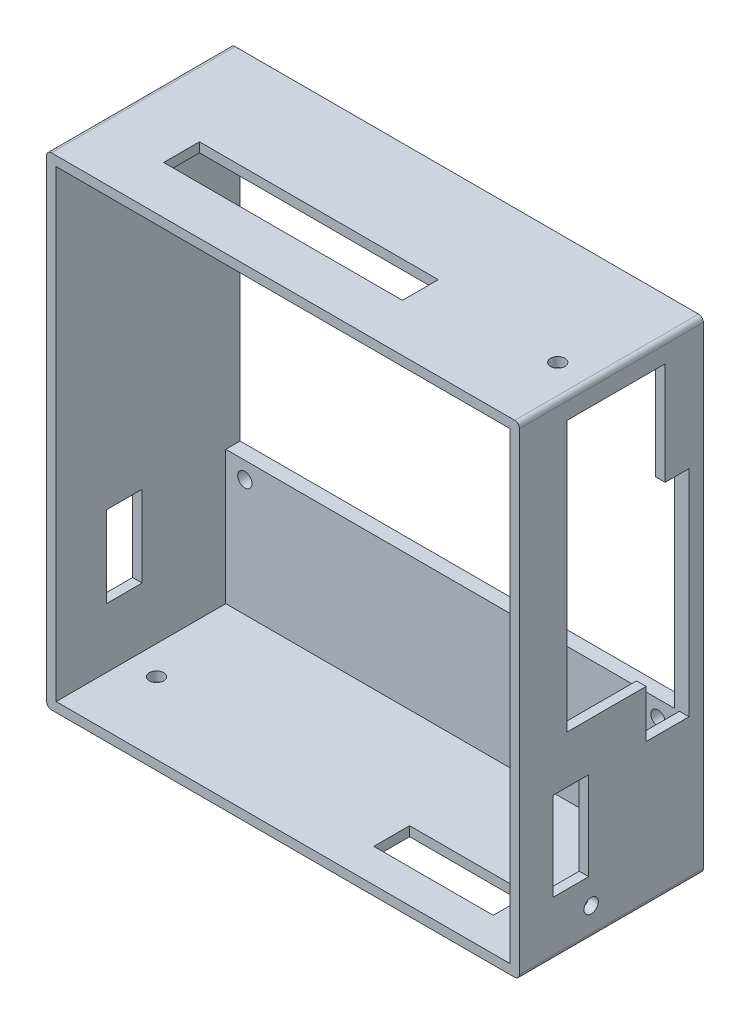
from build123d import *

# Parameters (mm, degrees)
SKETCH_1_W           = 99
SKETCH_1_H           = 104
SKETCH_1_R           = 1.5
SKETCH_1_W_2         = 95
SKETCH_1_H_2         = 61
EXTRUDE_3_DEPTH      = 3
SKETCH_3_W           = 99
SKETCH_3_H           = 104
SKETCH_3_W_2         = 95
SKETCH_3_H_2         = 100
EXTRUDE_4_DEPTH      = 33
CUT_EXTRUDE_2_DEPTH  = 30
SKETCH_5_W           = 50
SKETCH_5_H           = 7.5
CUT_EXTRUDE_3_DEPTH  = 30
SKETCH_6_W           = 28
SKETCH_6_H           = 55
CUT_EXTRUDE_4_DEPTH  = 30
SKETCH_7_W           = 7.5
SKETCH_7_H           = 18.5
CUT_EXTRUDE_5_DEPTH  = 30
SKETCH_8_W           = 25
SKETCH_8_H           = 7.5
CUT_EXTRUDE_6_DEPTH  = 30
FILLET_1_R           = 1
SKETCH_9_W           = 2
SKETCH_9_H           = 55
EXTRUDE_5_DEPTH      = 7.5
SKETCH_14_W          = 95
SKETCH_14_H          = 33
SKETCH_14_W_2        = 25
SKETCH_14_H_2        = 7.5
EXTRUDE_6_DEPTH      = 3
SKETCH_15_W          = 178.19226754
SKETCH_15_H          = 134.394802541
CUT_EXTRUDE_8_DEPTH  = 3
EXTRUDE_7_DEPTH      = 3
SKETCH_17_W          = 7.5
SKETCH_17_H          = 17
CUT_EXTRUDE_9_DEPTH  = 3
FILLET_3_R           = 1
SKETCH_19_W          = 95
SKETCH_19_H          = 97
EXTRUDE_8_DEPTH      = 2.5
SKETCH_20_W          = 2
SKETCH_20_H          = 20.5
EXTRUDE_9_DEPTH      = 2.5
CUT_EXTRUDE_10_DEPTH = 2
EXTRUDE_11_DEPTH     = 2
SKETCH_24_R          = 1.5
CUT_EXTRUDE_11_DEPTH = 2
SKETCH_25_R          = 1.5
CUT_EXTRUDE_12_DEPTH = 2
SKETCH_26_R          = 1.5
CUT_EXTRUDE_13_DEPTH = 2
SKETCH_27_R          = 1.5
CUT_EXTRUDE_14_DEPTH = 2
SKETCH_28_W          = 2
SKETCH_28_H          = 16.5
CUT_EXTRUDE_15_DEPTH = 4
SKETCH_29_W          = 6
SKETCH_29_H          = 7.5
EXTRUDE_12_DEPTH     = 2
SKETCH_30_W          = 6
SKETCH_30_H          = 7.5
CUT_EXTRUDE_16_DEPTH = 2


with BuildPart() as part:
    # 草图1 → 凸台-拉伸3 (new body)
    with BuildSketch(Plane.XY):
        with Locations((0, -11.5)):
            Rectangle(SKETCH_1_W, SKETCH_1_H)
        with Locations((43, 34)):
            Circle(SKETCH_1_R, mode=Mode.SUBTRACT)
        with Locations((-43.5, 34)):
            Circle(SKETCH_1_R, mode=Mode.SUBTRACT)
        with Locations((-43.5, -34)):
            Circle(SKETCH_1_R, mode=Mode.SUBTRACT)
        with Locations((43, -34)):
            Circle(SKETCH_1_R, mode=Mode.SUBTRACT)
        Rectangle(SKETCH_1_W_2, SKETCH_1_H_2, mode=Mode.SUBTRACT)
    extrude(amount=EXTRUDE_3_DEPTH)

    # 草图3 → 凸台-拉伸4 (add)
    with BuildSketch(Plane.XY.offset(3)):
        with Locations((0, -11.5)):
            Rectangle(SKETCH_3_W, SKETCH_3_H)
        with Locations((0, -11.5)):
            Rectangle(SKETCH_3_W_2, SKETCH_3_H_2, mode=Mode.SUBTRACT)
    extrude(amount=EXTRUDE_4_DEPTH)

    # 草图4 → 切除-拉伸2 (cut)
    with BuildSketch(Plane.ZY.offset(-47.5)):
        Polygon((12, 14.5), (12, -30.5), (3, -30.5), (0, -30.5), (0, 14.5), align=None)
    extrude(amount=-CUT_EXTRUDE_2_DEPTH, mode=Mode.SUBTRACT)

    # 草图5 → 切除-拉伸3 (cut)
    with BuildSketch(Plane(origin=(0, 40.5, 0), x_dir=(1, 0, 0), z_dir=(0, 1, 0))):
        with Locations((-10, -24.75)):
            Rectangle(SKETCH_5_W, SKETCH_5_H)
    extrude(amount=-CUT_EXTRUDE_3_DEPTH, mode=Mode.SUBTRACT)

    # 草图6 → 切除-拉伸4 (cut)
    with BuildSketch(Plane.ZY.offset(-47.5)):
        with Locations((22, 11)):
            Rectangle(SKETCH_6_W, SKETCH_6_H)
    extrude(amount=-CUT_EXTRUDE_4_DEPTH, mode=Mode.SUBTRACT)

    # 草图7 → 切除-拉伸5 (cut)
    with BuildSketch(Plane.ZY.offset(-47.5)):
        with Locations((27.75, -39.75)):
            Rectangle(SKETCH_7_W, SKETCH_7_H)
    extrude(amount=-CUT_EXTRUDE_5_DEPTH, mode=Mode.SUBTRACT)

    # 草图8 → 切除-拉伸6 (cut)
    with BuildSketch(Plane(origin=(0, -61.5, 0), x_dir=(1, 0, 0), z_dir=(0, 1, 0))):
        with Locations((27.5, -24.75)):
            Rectangle(SKETCH_8_W, SKETCH_8_H)
    extrude(amount=-CUT_EXTRUDE_6_DEPTH, mode=Mode.SUBTRACT)

    # 圆角1
    fillet_1_edges = [part.edges().sort_by_distance(p)[0] for p in [
        (-49.5, 40.5, 18),
        (49.5, 40.5, 18),
        (49.5, -63.5, 18),
        (-49.5, -63.5, 18),
    ]]
    fillet(fillet_1_edges, radius=FILLET_1_R)

    # 草图9 → 凸台-拉伸5 (add)
    with BuildSketch(Plane.XY.offset(36)):
        with Locations((48.5, 11)):
            Rectangle(SKETCH_9_W, SKETCH_9_H)
    extrude(amount=-EXTRUDE_5_DEPTH)

    # 草图14 → 凸台-拉伸6 (add)
    with BuildSketch(Plane(origin=(0, -61.5, 0), x_dir=(1, 0, 0), z_dir=(0, 1, 0))):
        with Locations((0, -19.5)):
            Rectangle(SKETCH_14_W, SKETCH_14_H)
        with Locations((27.5, -24.75)):
            Rectangle(SKETCH_14_W_2, SKETCH_14_H_2, mode=Mode.SUBTRACT)
    extrude(amount=EXTRUDE_6_DEPTH)

    # 草图15 → 切除-拉伸8 (cut)
    with BuildSketch(Plane.XZ.offset(63.5)):
        with Locations((3.050514682, 15.901855456)):
            Rectangle(SKETCH_15_W, SKETCH_15_H)
    extrude(amount=-CUT_EXTRUDE_8_DEPTH, mode=Mode.SUBTRACT)

    # 草图16 → 凸台-拉伸7 (add)
    with BuildSketch(Plane(origin=(0, 0, 0), x_dir=(-1, 0, 0), z_dir=(0, 0, -1))):
        Polygon((-47.5, 30.5), (-46.5, 30.5), (-46.5, -30.5), (-49.5, -30.5), (-49.5, 14.5), (-47.5, 14.5), align=None)
    extrude(amount=-EXTRUDE_7_DEPTH)

    # 草图17 → 切除-拉伸9 (cut)
    with BuildSketch(Plane.ZY.offset(49.5)):
        with Locations((24.25, -37.5)):
            Rectangle(SKETCH_17_W, SKETCH_17_H)
    extrude(amount=-CUT_EXTRUDE_9_DEPTH, mode=Mode.SUBTRACT)

    # 圆角3
    fillet_3_edges = [part.edges().sort_by_distance(p)[0] for p in [
        (-49.5, -60.5, 18),
        (49.5, -60.5, 18),
    ]]
    fillet(fillet_3_edges, radius=FILLET_3_R)

    # 草图19 → 凸台-拉伸8 (add)
    with BuildSketch(Plane.XY.offset(36)):
        with BuildLine():
            Line((-49.5, 39.5), (-49.5, -59.5))
            ThreePointArc((-49.5, -59.5), (-49.207106781, -60.207106781), (-48.5, -60.5))
            Line((-48.5, -60.5), (48.5, -60.5))
            ThreePointArc((48.5, -60.5), (49.207106781, -60.207106781), (49.5, -59.5))
            Line((49.5, -59.5), (49.5, 39.5))
            ThreePointArc((49.5, 39.5), (49.207106781, 40.207106781), (48.5, 40.5))
            Line((48.5, 40.5), (-48.5, 40.5))
            ThreePointArc((-48.5, 40.5), (-49.207106781, 40.207106781), (-49.5, 39.5))
        make_face()
        with Locations((0, -10)):
            Rectangle(SKETCH_19_W, SKETCH_19_H, mode=Mode.SUBTRACT)
    extrude(amount=EXTRUDE_8_DEPTH)

    # 草图20 → 凸台-拉伸9 (add)
    with BuildSketch(Plane.XZ.offset(-38.5)):
        with Locations((48.5, 18.25)):
            Rectangle(SKETCH_20_W, SKETCH_20_H)
    extrude(amount=EXTRUDE_9_DEPTH)

    # 草图21 → 切除-拉伸10 (cut)
    with BuildSketch(Plane.XZ.offset(60.5)):
        Polygon((43, 24), (43, 31.5), (18, 31.5), (18, 28.5), (40, 28.5), (40, 24), align=None)
    extrude(amount=-CUT_EXTRUDE_10_DEPTH, mode=Mode.SUBTRACT)

    # 草图23 → 凸台-拉伸11 (add)
    with BuildSketch(Plane.XZ.offset(60.5)):
        Polygon((15, 28.5), (18, 28.5), (18, 24), (40, 24), (40, 21), (15, 21), align=None)
    extrude(amount=-EXTRUDE_11_DEPTH)

    # 草图24 → 切除-拉伸11 (cut)
    with BuildSketch(Plane(origin=(49.5, 0, 0), x_dir=(0, 0, -1), z_dir=(1, 0, 0))):
        with Locations((-23.5, -54.5)):
            Circle(SKETCH_24_R)
    extrude(amount=-CUT_EXTRUDE_11_DEPTH, mode=Mode.SUBTRACT)

    # 草图25 → 切除-拉伸12 (cut)
    with BuildSketch(Plane.XZ.offset(60.5)):
        with Locations((-41.5, 23.5)):
            Circle(SKETCH_25_R)
    extrude(amount=-CUT_EXTRUDE_12_DEPTH, mode=Mode.SUBTRACT)

    # 草图26 → 切除-拉伸13 (cut)
    with BuildSketch(Plane.ZY.offset(49.5)):
        with Locations((23.5, 33.5)):
            Circle(SKETCH_26_R)
    extrude(amount=-CUT_EXTRUDE_13_DEPTH, mode=Mode.SUBTRACT)

    # 草图27 → 切除-拉伸14 (cut)
    with BuildSketch(Plane(origin=(0, 40.5, 0), x_dir=(1, 0, 0), z_dir=(0, 1, 0))):
        with Locations((42.5, -23.5)):
            Circle(SKETCH_27_R)
    extrude(amount=-CUT_EXTRUDE_14_DEPTH, mode=Mode.SUBTRACT)

    # 草图28 → 切除-拉伸15 (cut)
    with BuildSketch(Plane(origin=(0, -16.5, 0), x_dir=(1, 0, 0), z_dir=(0, 1, 0))):
        with Locations((48.5, -20.25)):
            Rectangle(SKETCH_28_W, SKETCH_28_H)
    extrude(amount=-CUT_EXTRUDE_15_DEPTH, mode=Mode.SUBTRACT)

    # 草图29 → 凸台-拉伸12 (add)
    with BuildSketch(Plane.XZ.offset(60.5)):
        with Locations((40, 27.75)):
            Rectangle(SKETCH_29_W, SKETCH_29_H)
    extrude(amount=-EXTRUDE_12_DEPTH)

    # 草图30 → 切除-拉伸16 (cut)
    with BuildSketch(Plane.XZ.offset(60.5)):
        with Locations((15, 27.75)):
            Rectangle(SKETCH_30_W, SKETCH_30_H)
    extrude(amount=-CUT_EXTRUDE_16_DEPTH, mode=Mode.SUBTRACT)


solid = part.part
